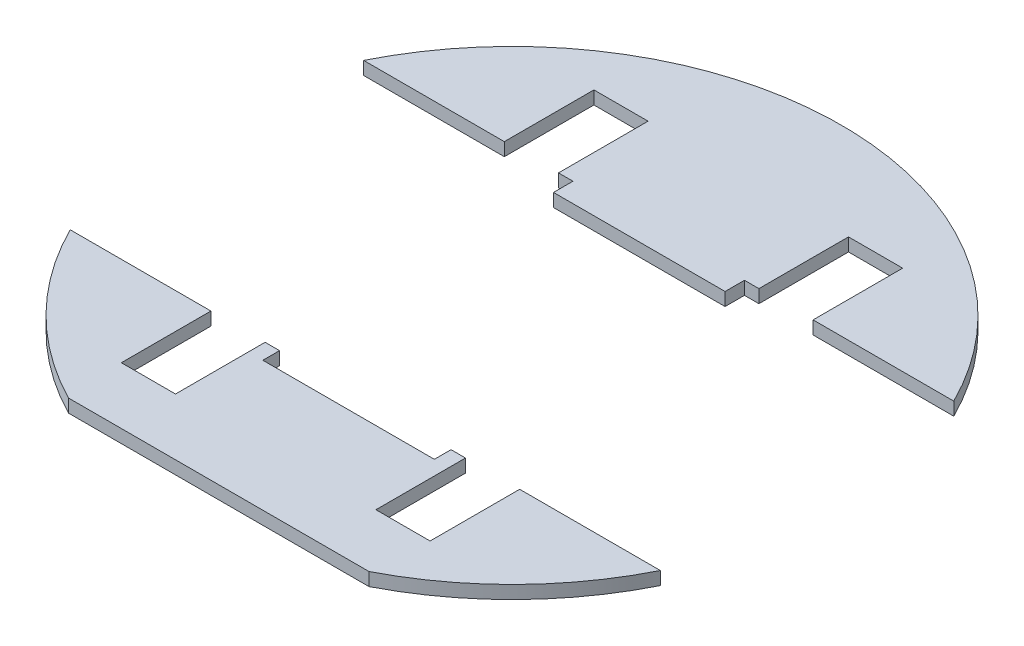
from build123d import *

# Parameters (mm, degrees)
BOSS_EXTRUDE1_DEPTH = 2.9
CUT_EXTRUDE1_DEPTH  = 104.278313309
SKETCH3_W           = 38.8
SKETCH3_H           = 65
CUT_EXTRUDE2_DEPTH  = 104.278313309


with BuildPart() as part:
    # Sketch1 → Boss-Extrude1 (new body)
    with BuildSketch(Plane(origin=(0, 0, 0), x_dir=(1, 0, 0), z_dir=(0, 1, 0))):
        with BuildLine():
            Line((-33.29110537, -64.966932383), (33.29110537, -64.966932383))
            ThreePointArc((33.29110537, -64.966932383), (0, 73), (-33.29110537, -64.966932383))
        make_face()
    extrude(amount=BOSS_EXTRUDE1_DEPTH)

    # Sketch2 → Cut-Extrude1 (cut, through all)
    with BuildSketch(Plane(origin=(0, 2.9, 0), x_dir=(1, 0, 0), z_dir=(0, 1, 0))):
        Polygon((-34.2, 52.344931419), (-34.2, -52.344931419), (-22.2, -52.344931419), (-22.2, -32.5), (-19, -32.5), (-19, -36.2), (-18, -36.2), (18, -36.2), (19, -36.2), (19, -32.5), (22.2, -32.5), (22.2, -52.344931419), (34.2, -52.344931419), (34.2, 52.344931419), (22.2, 52.344931419), (22.2, 32.5), (19, 32.5), (19, 28.2), (-19, 28.2), (-19, 32.5), (-22.2, 32.5), (-22.2, 52.344931419), align=None)
    extrude(amount=-CUT_EXTRUDE1_DEPTH, mode=Mode.SUBTRACT)

    # Sketch3 → Cut-Extrude2 (cut, through all)
    with BuildSketch(Plane(origin=(0, 2.9, 0), x_dir=(1, 0, 0), z_dir=(0, 1, 0))):
        with Locations((-53.6, 0)):
            Rectangle(SKETCH3_W, SKETCH3_H)
        with Locations((53.6, 0)):
            Rectangle(SKETCH3_W, SKETCH3_H)
    extrude(amount=-CUT_EXTRUDE2_DEPTH, mode=Mode.SUBTRACT)


with BuildPart() as cut_extrude2_piece_1:
    # of the separate pieces the step leaves, piece 1, a body of its own (cut_extrude2_pieces)
    add(part.part.solids().sort_by_distance((65.366275709, 0, -32.5))[0])


with BuildPart() as cut_extrude2_piece_2:
    # of the separate pieces the step leaves, piece 2, a body of its own (cut_extrude2_pieces)
    add(part.part.solids().sort_by_distance((-33.29110537, 0, 64.966932383))[0])


solid = Compound([cut_extrude2_piece_1.part, cut_extrude2_piece_2.part])
